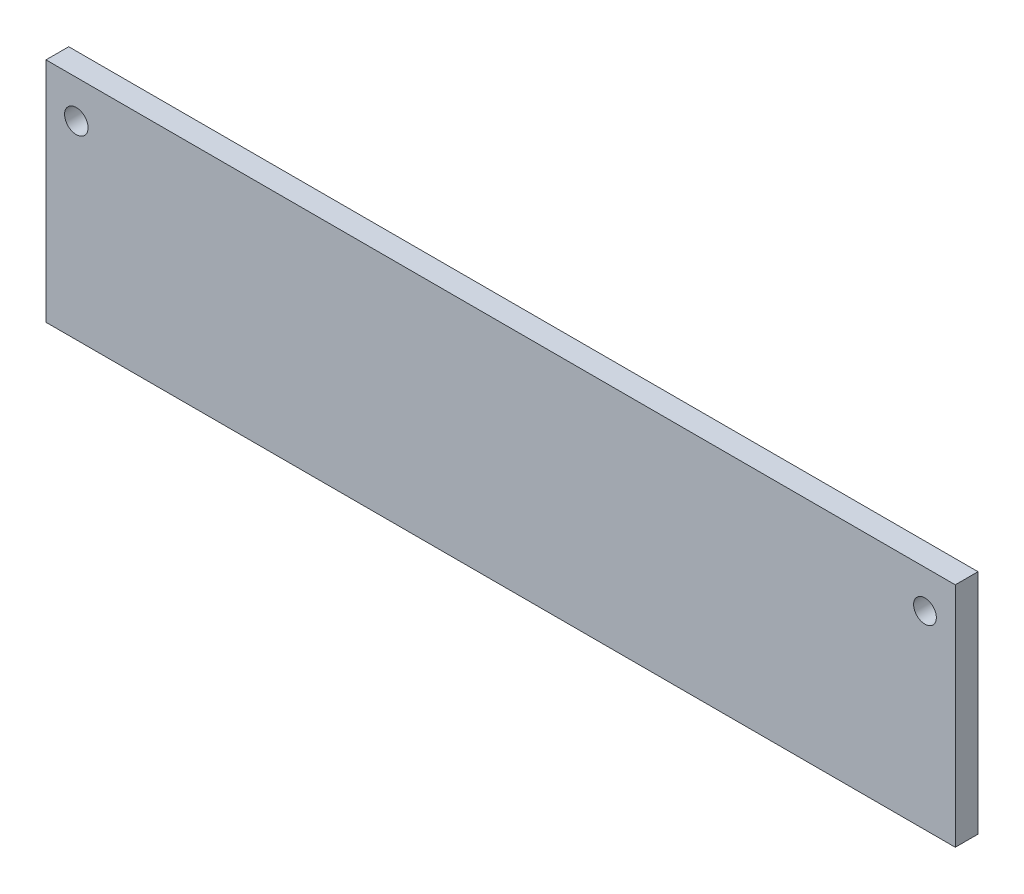
from build123d import *

# Parameters (mm, degrees)
SKETCH_1_W          = 120
SKETCH_1_H          = 30
EXTRUDE_1_DEPTH     = 3
SKETCH_3_R          = 1.5
SKETCH_3_R_2        = 1.55
CUT_EXTRUDE_2_DEPTH = 10


with BuildPart() as part:
    # 草图1 → 凸台-拉伸1 (new body)
    with BuildSketch(Plane.XY):
        Rectangle(SKETCH_1_W, SKETCH_1_H)
    extrude(amount=EXTRUDE_1_DEPTH)

    # 草图3 → 切除-拉伸2 (cut)
    with BuildSketch(Plane(origin=(0, 0, 0), x_dir=(-1, 0, 0), z_dir=(0, 0, -1))):
        with Locations((-56, 10)):
            Circle(SKETCH_3_R)
        with Locations((56, 10)):
            Circle(SKETCH_3_R_2)
    extrude(amount=-CUT_EXTRUDE_2_DEPTH, mode=Mode.SUBTRACT)


solid = part.part
